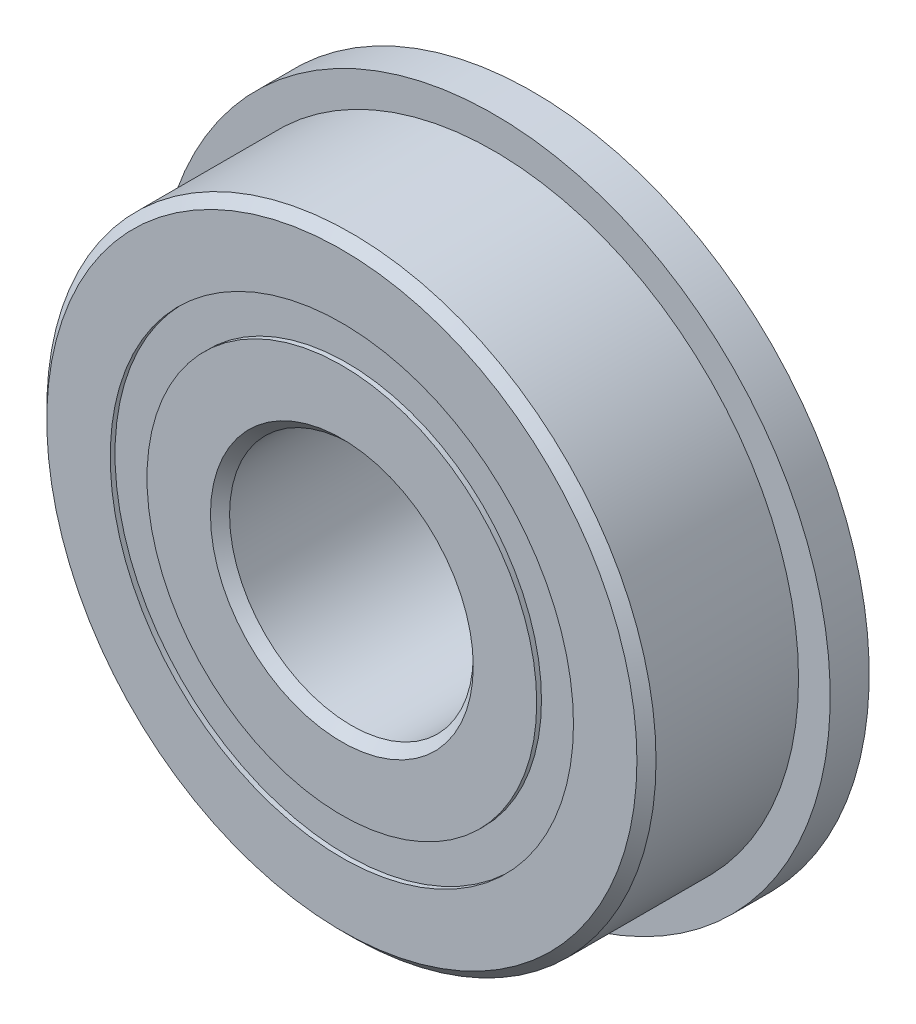
from build123d import *

# Parameters (mm, degrees)
CIRPATTERN1_COUNT = 14
SKETCH5_W         = 1.15919535
SKETCH5_H         = 0.957942858
SKETCH6_W         = 1.016
SKETCH6_H         = 2.727778571


with BuildPart() as part:
    # Sketch1 → Revolve1 (revolve)
    with BuildSketch(Plane(origin=(0, 0, 0), x_dir=(0, 0, -1), z_dir=(1, 0, 0))):
        with BuildLine():
            Line((2.24028, 7.9375), (-2.24028, 7.9375))
            Line((-2.24028, 7.9375), (-2.4892, 7.68858))
            Line((-2.4892, 7.68858), (-2.4892, 6.035221429))
            Line((-2.4892, 6.035221429), (-1.106311111, 6.035221429))
            ThreePointArc((-1.106311111, 6.035221429), (0, 6.76179465), (1.106311111, 6.035221429))
            Line((1.106311111, 6.035221429), (2.4892, 6.035221429))
            Line((2.4892, 6.035221429), (2.4892, 7.68858))
            Line((2.4892, 7.68858), (2.24028, 7.9375))
        make_face()
    revolve(axis=Axis((0, 0, 2.4892), (0, 0, -1)))

    # Sketch6 → Revolve6 (revolve)
    with BuildSketch(Plane(origin=(0, 0, 0), x_dir=(0, 0, -1), z_dir=(1, 0, 0))):
        with Locations((1.9812, 7.399110715)):
            Rectangle(SKETCH6_W, SKETCH6_H)
    revolve(axis=Axis((0, 0, -2.4892), (0, 0, 1)))


with BuildPart() as body_2:
    # Sketch3 → Revolve3 (revolve)
    with BuildSketch(Plane(origin=(0, 0, 0), x_dir=(0, 0, -1), z_dir=(1, 0, 0))):
        with BuildLine():
            Line((-2.4892, 5.077278571), (-1.106311111, 5.077278571))
            ThreePointArc((-1.106311111, 5.077278571), (0, 4.35070535), (1.106311111, 5.077278571))
            Line((1.106311111, 5.077278571), (2.4892, 5.077278571))
            Line((2.4892, 5.077278571), (2.4892, 3.42392))
            Line((2.4892, 3.42392), (2.24028, 3.175))
            Line((2.24028, 3.175), (-2.24028, 3.175))
            Line((-2.24028, 3.175), (-2.4892, 3.42392))
            Line((-2.4892, 3.42392), (-2.4892, 5.077278571))
        make_face()
    revolve(axis=Axis((0, 0, 2.4892), (0, 0, -1)))


with BuildPart() as body_3:
    # Sketch4 → Revolve4 (revolve)
    with BuildSketch(Plane(origin=(0, 0, 0), x_dir=(0, 0, -1), z_dir=(1, 0, 0))):
        with BuildLine():
            Line((-1.20554465, 5.55625), (1.20554465, 5.55625))
            ThreePointArc((1.20554465, 5.55625), (0, 6.76179465), (-1.20554465, 5.55625))
        make_face()
    revolve(axis=Axis((0, 5.55625, 1.20554465), (0, 0, -1)))


with BuildPart() as cirpattern1_1:
    # CirPattern1: pattern copy
    add(body_3.part.rotate(Axis((0, 0, -2.4892), (0, 0, 1)), 1 * 360 / CIRPATTERN1_COUNT))


with BuildPart() as cirpattern1_2:
    # CirPattern1: pattern copy
    add(body_3.part.rotate(Axis((0, 0, -2.4892), (0, 0, 1)), 2 * 360 / CIRPATTERN1_COUNT))


with BuildPart() as cirpattern1_3:
    # CirPattern1: pattern copy
    add(body_3.part.rotate(Axis((0, 0, -2.4892), (0, 0, 1)), 3 * 360 / CIRPATTERN1_COUNT))


with BuildPart() as cirpattern1_4:
    # CirPattern1: pattern copy
    add(body_3.part.rotate(Axis((0, 0, -2.4892), (0, 0, 1)), 4 * 360 / CIRPATTERN1_COUNT))


with BuildPart() as cirpattern1_5:
    # CirPattern1: pattern copy
    add(body_3.part.rotate(Axis((0, 0, -2.4892), (0, 0, 1)), 5 * 360 / CIRPATTERN1_COUNT))


with BuildPart() as cirpattern1_6:
    # CirPattern1: pattern copy
    add(body_3.part.rotate(Axis((0, 0, -2.4892), (0, 0, 1)), 6 * 360 / CIRPATTERN1_COUNT))


with BuildPart() as cirpattern1_7:
    # CirPattern1: pattern copy
    add(body_3.part.rotate(Axis((0, 0, -2.4892), (0, 0, 1)), 7 * 360 / CIRPATTERN1_COUNT))


with BuildPart() as cirpattern1_8:
    # CirPattern1: pattern copy
    add(body_3.part.rotate(Axis((0, 0, -2.4892), (0, 0, 1)), 8 * 360 / CIRPATTERN1_COUNT))


with BuildPart() as cirpattern1_9:
    # CirPattern1: pattern copy
    add(body_3.part.rotate(Axis((0, 0, -2.4892), (0, 0, 1)), 9 * 360 / CIRPATTERN1_COUNT))


with BuildPart() as cirpattern1_10:
    # CirPattern1: pattern copy
    add(body_3.part.rotate(Axis((0, 0, -2.4892), (0, 0, 1)), 10 * 360 / CIRPATTERN1_COUNT))


with BuildPart() as cirpattern1_11:
    # CirPattern1: pattern copy
    add(body_3.part.rotate(Axis((0, 0, -2.4892), (0, 0, 1)), 11 * 360 / CIRPATTERN1_COUNT))


with BuildPart() as cirpattern1_12:
    # CirPattern1: pattern copy
    add(body_3.part.rotate(Axis((0, 0, -2.4892), (0, 0, 1)), 12 * 360 / CIRPATTERN1_COUNT))


with BuildPart() as cirpattern1_13:
    # CirPattern1: pattern copy
    add(body_3.part.rotate(Axis((0, 0, -2.4892), (0, 0, 1)), 13 * 360 / CIRPATTERN1_COUNT))


with BuildPart() as body_17:
    # Sketch5 → Revolve5 (revolve)
    with BuildSketch(Plane(origin=(0, 0, 0), x_dir=(0, 0, -1), z_dir=(1, 0, 0))):
        with Locations((-1.785142325, 5.55625)):
            Rectangle(SKETCH5_W, SKETCH5_H)
        with Locations((1.785142325, 5.55625)):
            Rectangle(SKETCH5_W, SKETCH5_H)
    revolve(axis=Axis((0, 0, 2.4892), (0, 0, -1)))


solid = Compound([part.part, body_2.part, body_3.part, cirpattern1_1.part, cirpattern1_2.part, cirpattern1_3.part, cirpattern1_4.part, cirpattern1_5.part, cirpattern1_6.part, cirpattern1_7.part, cirpattern1_8.part, cirpattern1_9.part, cirpattern1_10.part, cirpattern1_11.part, cirpattern1_12.part, cirpattern1_13.part, body_17.part])
